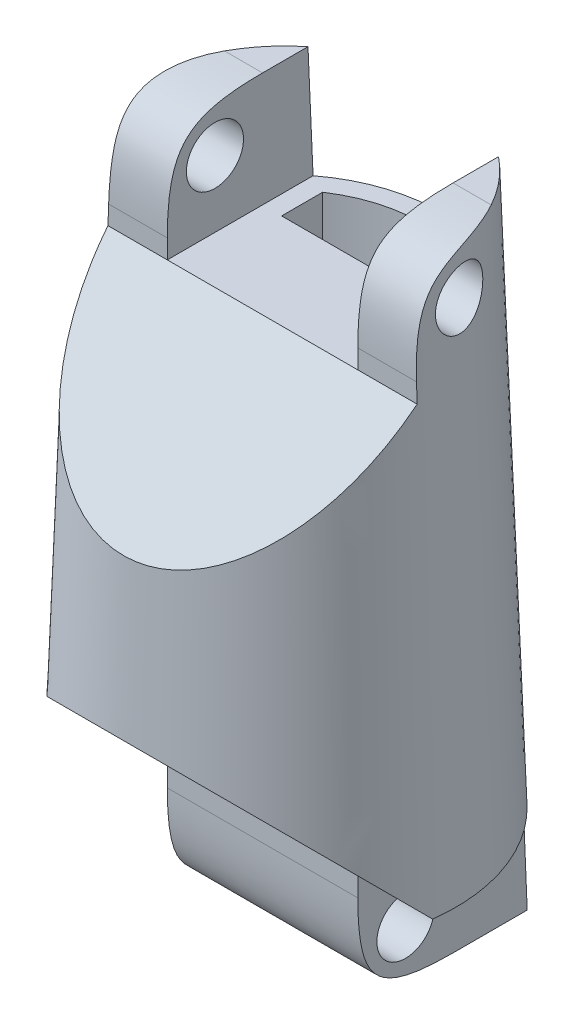
from build123d import *

# Parameters (mm, degrees)
SKETCH1_R                     = 9
BOSS_EXTRUDE1_DEPTH           = 29
BOSS_EXTRUDE1_TAPER           = 2
BOSS_EXTRUDE1_OTHER_WAY_DEPTH = 6
BOSS_EXTRUDE1_OTHER_WAY_TAPER = -2
CUT_EXTRUDE1_DEPTH            = 32.790418169
CUT_EXTRUDE1_DEPTH_BACK       = 32.790418169
CUT_EXTRUDE2_START            = -10.365035118
CUT_EXTRUDE2_OUTLINE_W        = 9.770566763
CUT_EXTRUDE2_OUTLINE_H        = 6
CUT_EXTRUDE2_DEPTH            = 10.365035118
CUT_EXTRUDE3_DEPTH            = 34.493511964
CUT_EXTRUDE3_DEPTH_BACK       = 34.493511964
SKETCH5_R                     = 1.5
FILLET1_SIZE                  = 5
CUT_EXTRUDE4_DEPTH            = 32.730353664
CUT_EXTRUDE4_DEPTH_BACK       = 32.730353664
SKETCH8_W                     = 10
SKETCH8_H                     = 6
CUT_EXTRUDE5_DEPTH            = 33.084793141
CUT_EXTRUDE6_DEPTH            = 34.493511964
CUT_EXTRUDE6_DEPTH_BACK       = 34.493511964
SKETCH9_R                     = 1.5
FILLET2_SIZE                  = 5
CUT_EXTRUDE7_DEPTH            = 38.293636915


with BuildPart() as part:
    # Sketch1 → Boss-Extrude1 (new body)
    with BuildSketch(Plane(origin=(0, 0, 0), x_dir=(1, 0, 0), z_dir=(0, 1, 0))):
        Circle(SKETCH1_R)
    extrude(amount=BOSS_EXTRUDE1_DEPTH, taper=BOSS_EXTRUDE1_TAPER)

    # Sketch1 → Boss-Extrude1 other way (add)
    with BuildSketch(Plane(origin=(0, 0, 0), x_dir=(1, 0, 0), z_dir=(0, 1, 0))):
        Circle(SKETCH1_R)
    extrude(amount=-BOSS_EXTRUDE1_OTHER_WAY_DEPTH, taper=BOSS_EXTRUDE1_OTHER_WAY_TAPER)

    # Sketch3 → Cut-Extrude1 (cut, two sides: drawn at the far end of the back side and taken through both)
    with BuildSketch(Plane(origin=(0, 0, 0), x_dir=(0, 0, -1), z_dir=(1, 0, 0)).offset(-CUT_EXTRUDE1_DEPTH_BACK)):
        Polygon((-1.155510401, -6), (-1.155510401, 0), (-11.155510401, 10), (-11.155510401, -6), align=None)
    extrude(amount=CUT_EXTRUDE1_DEPTH + CUT_EXTRUDE1_DEPTH_BACK, mode=Mode.SUBTRACT)

    # Cut-Extrude2: read off the stored shape, not the designer's step
    # Cut-Extrude2 outline → Cut-Extrude2 (cut)
    with BuildSketch(Plane.XY.offset(1.155510401).offset(CUT_EXTRUDE2_START)):
        with Locations((-9.885283382, -3)):
            Rectangle(CUT_EXTRUDE2_OUTLINE_W, CUT_EXTRUDE2_OUTLINE_H)
        with Locations((9.885283382, -3)):
            Rectangle(CUT_EXTRUDE2_OUTLINE_W, CUT_EXTRUDE2_OUTLINE_H)
    extrude(amount=CUT_EXTRUDE2_DEPTH, mode=Mode.SUBTRACT)

    # Sketch5 → Cut-Extrude3 (cut, two sides: drawn at the far end of the back side and taken through both)
    with BuildSketch(Plane.ZY.offset(5).offset(-CUT_EXTRUDE3_DEPTH_BACK)):
        with Locations(Location((-1.344489599, -3.5, 0), (0, 0, 270))):
            Circle(SKETCH5_R)
    extrude(amount=CUT_EXTRUDE3_DEPTH + CUT_EXTRUDE3_DEPTH_BACK, mode=Mode.SUBTRACT)

    # Fillet1
    # a fillet whose section is not a circle: 5 mm, written as the material it takes off along each edge
    with BuildSketch(Plane(origin=(17.5, -6, 1.155510401), x_dir=(0, 0, -1), z_dir=(-1, 0, 0))) as fillet1_piece_1:
        with BuildLine():
            Bezier((FILLET1_SIZE, 0), (0, 0), (0, -FILLET1_SIZE), weights=[1, 1.5, 1])
            Line((0, -FILLET1_SIZE), (0, 0))
            Line((0, 0), (FILLET1_SIZE, 0))
        make_face()
    extrude(amount=35, mode=Mode.SUBTRACT)

    # Sketch7 → Cut-Extrude4 (cut, two sides: drawn at the far end of the back side and taken through both)
    with BuildSketch(Plane(origin=(0, 0, 0), x_dir=(0, 0, -1), z_dir=(1, 0, 0)).offset(-CUT_EXTRUDE4_DEPTH_BACK)):
        Polygon((-1.155510401, 29), (-1.155510401, 23), (-12.24506556, 11.91044484), (-12.24506556, 29), align=None)
    extrude(amount=CUT_EXTRUDE4_DEPTH + CUT_EXTRUDE4_DEPTH_BACK, mode=Mode.SUBTRACT)

    # Sketch8 → Cut-Extrude5 (cut, through all)
    with BuildSketch(Plane.XY.offset(1.155510401)):
        with Locations((0, 26)):
            Rectangle(SKETCH8_W, SKETCH8_H)
    extrude(amount=-CUT_EXTRUDE5_DEPTH, mode=Mode.SUBTRACT)

    # Sketch9 → Cut-Extrude6 (cut, two sides: drawn at the far end of the back side and taken through both)
    with BuildSketch(Plane(origin=(-5, 0, 0), x_dir=(0, 0, -1), z_dir=(1, 0, 0)).offset(-CUT_EXTRUDE6_DEPTH_BACK)):
        with Locations(Location((1.344489599, 26.5, 0), (0, 0, 298.528207369))):
            Circle(SKETCH9_R)
    extrude(amount=CUT_EXTRUDE6_DEPTH + CUT_EXTRUDE6_DEPTH_BACK, mode=Mode.SUBTRACT)

    # Fillet2
    # a fillet whose section is not a circle: 5 mm, written as the material it takes off along each edge
    with BuildSketch(Plane(origin=(-20.403272741, 29, 1.155510401), x_dir=(0, 0, -1), z_dir=(1, 0, 0))) as fillet2_piece_1:
        with BuildLine():
            Bezier((FILLET2_SIZE, 0), (0, 0), (0, -FILLET2_SIZE), weights=[1, 1.5, 1])
            Line((0, -FILLET2_SIZE), (0, 0))
            Line((0, 0), (FILLET2_SIZE, 0))
        make_face()
    extrude(amount=27.903272741, mode=Mode.SUBTRACT)
    with BuildSketch(Plane(origin=(-7.5, 29, 1.155510401), x_dir=(0, -1, 0), z_dir=(1, 0, 0))) as fillet2_piece_2:
        with BuildLine():
            Bezier((FILLET2_SIZE, 0), (0, 0), (0, FILLET2_SIZE), weights=[1, 1.5, 1])
            Line((0, FILLET2_SIZE), (0, 0))
            Line((0, 0), (FILLET2_SIZE, 0))
        make_face()
    extrude(amount=27.903272741, mode=Mode.SUBTRACT)

    # Sketch10 → Cut-Extrude7 (cut, through all)
    with BuildSketch(Plane.XZ.offset(6)):
        with BuildLine():
            Line((-4, -3.844489599), (-4, -5.998103467))
            ThreePointArc((-4, -5.998103467), (0, -7.209524617), (4, -5.998103467))
            Line((4, -5.998103467), (4, -3.844489599))
            Line((4, -3.844489599), (-4, -3.844489599))
        make_face()
    extrude(amount=-CUT_EXTRUDE7_DEPTH, mode=Mode.SUBTRACT)


solid = part.part
